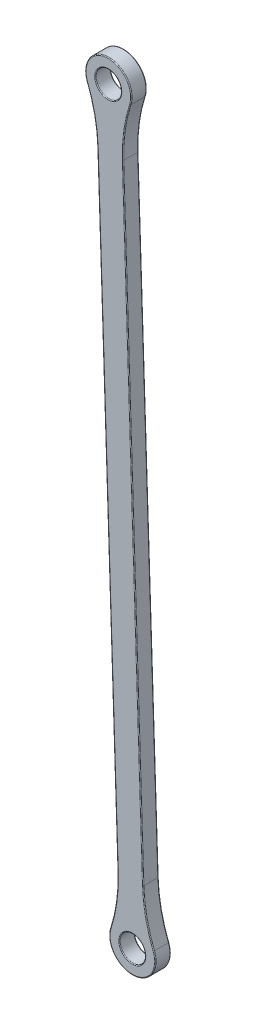
from build123d import *

# Parameters (mm, degrees)
SKETCH1_R           = 2.5
BOSS_EXTRUDE1_DEPTH = 3
FILLET1_R           = 30
FILLET2_R           = 0.15


with BuildPart() as part:
    # Sketch1 → Boss-Extrude1 (new body)
    with BuildSketch(Plane.XY):
        with BuildLine():
            ThreePointArc((9.880421032, 85.092977896), (12.647753877, 76.937195566), (14.877763753, 85.255967858))
            Line((14.877763753, 85.255967858), (10.429307603, 221.647557195))
            ThreePointArc((10.429307603, 221.647557195), (7.661974758, 229.803339524), (5.431964882, 221.484567233))
            Line((5.431964882, 221.484567233), (9.880421032, 85.092977896))
        make_face()
        with Locations((12.501062912, 81.434804015)):
            Circle(SKETCH1_R, mode=Mode.SUBTRACT)
        with Locations((7.808665723, 225.305731075)):
            Circle(SKETCH1_R, mode=Mode.SUBTRACT)
    extrude(amount=-BOSS_EXTRUDE1_DEPTH)

    # Fillet1
    fillet1_edges = [part.edges().sort_by_distance(p)[0] for p in [
        (5.431964882, 221.484567233, -1.5),
        (10.429307603, 221.647557195, -1.5),
        (9.880421032, 85.092977896, -1.5),
        (14.877763753, 85.255967858, -1.5),
    ]]
    fillet(fillet1_edges, radius=FILLET1_R)

    # Fillet2
    fillet2_edges = [part.edges().sort_by_distance(p)[0] for p in [
        (10.001062912, 81.434804015, 0),
        (5.083100937, 218.745098731, 0),
        (7.661974758, 229.803339524, 0),
        (10.955937549, 218.936643212, 0),
        (12.653535678, 153.451762526, 0),
        (15.226627698, 87.99543636, 0),
        (12.647753877, 76.937195566, 0),
        (9.353791085, 87.803891879, 0),
        (7.656192957, 153.288772564, 0),
        (5.308665723, 225.305731075, 0),
        (5.308665723, 225.305731075, -3),
        (10.001062912, 81.434804015, -3),
        (7.656192957, 153.288772564, -3),
        (9.353791085, 87.803891879, -3),
        (12.647753877, 76.937195566, -3),
        (15.226627698, 87.99543636, -3),
        (12.653535678, 153.451762526, -3),
        (5.083100937, 218.745098731, -3),
        (10.955937549, 218.936643212, -3),
        (7.661974758, 229.803339524, -3),
    ]]
    fillet(fillet2_edges, radius=FILLET2_R)


solid = part.part
